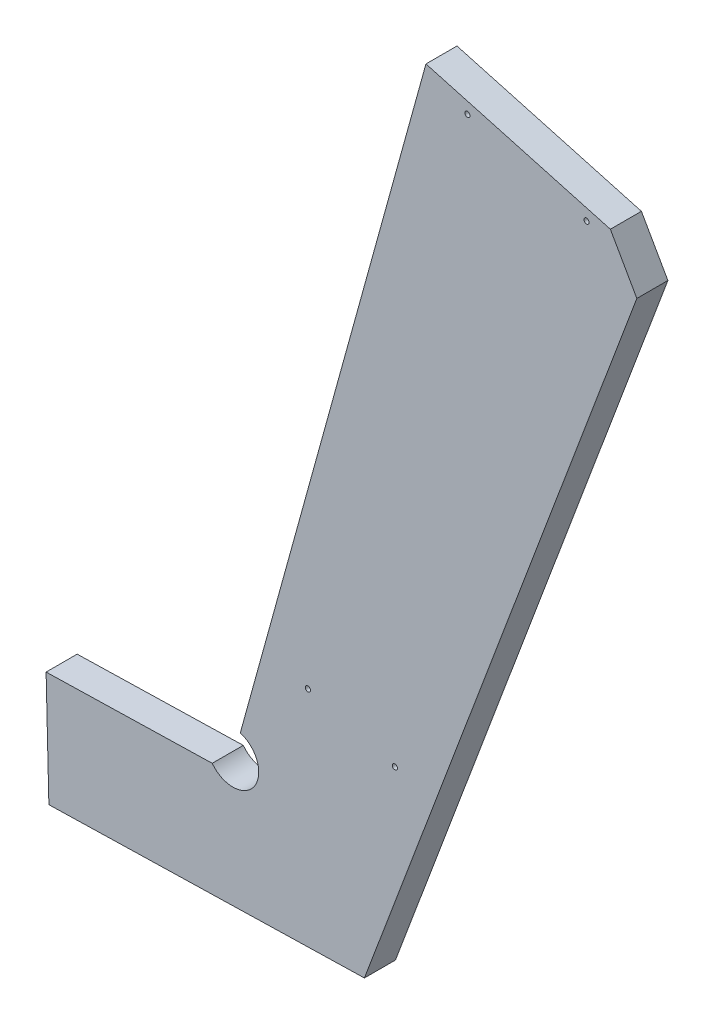
from build123d import *

# Parameters (mm, degrees)
BOSS_EXTRUDE1_DEPTH = 19.05
HOLE3_D             = 3.175
HOLE3_DEPTH         = 38.1
HOLE3_CSINK_D       = 10.16
HOLE3_CSINK_ANGLE   = 82
HOLE3_TIP           = 0.953866233


with BuildPart() as part:
    # Sketch1 → Boss-Extrude1 (new body)
    with BuildSketch(Plane.XY):
        with BuildLine():
            Line((-85.160107618, -534.890646796), (-83.459553046, -604.536867316))
            Line((-83.459553046, -604.536867316), (110.157739028, -599.809306096))
            Line((110.157739028, -599.809306096), (277.322178144, -155.105796357))
            Line((277.322178144, -155.105796357), (261.069157544, -126.448741632))
            Line((261.069157544, -126.448741632), (147.913577672, -95.195494697))
            Line((147.913577672, -95.195494697), (33.997973007, -507.638602732))
            ThreePointArc((33.997973007, -507.638602732), (42.480806483, -531.913781646), (16.770796424, -532.401795806))
            Line((16.770796424, -532.401795806), (-85.160107618, -534.890646796))
        make_face()
    extrude(amount=BOSS_EXTRUDE1_DEPTH)

    # Hole3
    with Locations(Plane(origin=(295.820901284, -105.894091108, -19.05), x_dir=(-0.3518626346959965, -0.9360516472421764, 8.51430303154421e-15), z_dir=(0, 0, -1))):
        with Locations((46.221112845, 113.488854888), (39.39759596, 37.945520226), (412.28786892, 80.423559293), (407.308516105, 25.297013484), (513.561319184, 161.164706775), (597.46020397, 127.267357003), (610.543339245, 159.649253123), (694.322923815, 367.011001477), (526.644454459, 193.546602895), (610.424039029, 400.908351249)):
            CounterSinkHole(HOLE3_D / 2, HOLE3_CSINK_D / 2, depth=HOLE3_DEPTH, counter_sink_angle=HOLE3_CSINK_ANGLE)
            with Locations((0, 0, -(HOLE3_DEPTH + HOLE3_TIP / 2))):  # 118° drill point
                Cone(0, HOLE3_D / 2, HOLE3_TIP, mode=Mode.SUBTRACT)


solid = part.part
